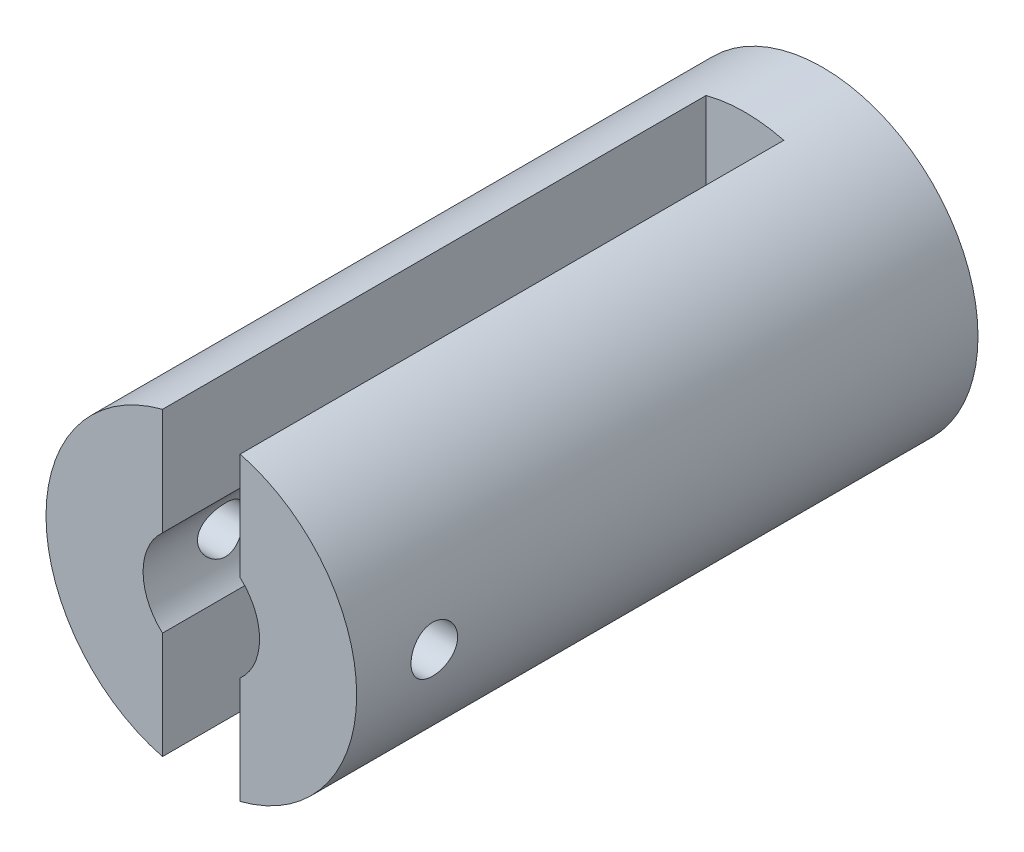
from build123d import *
from build123d.topology import SkipClean

# Parameters (mm, degrees)
CROQUIS1_R              = 10
CROQUIS1_R_2            = 2.25
SALIENTE_EXTRUIR1_DEPTH = 5
SALIENTE_EXTRUIR2_DEPTH = 35
CROQUIS3_R              = 1.5
CORTAR_EXTRUIR1_DEPTH   = 20
CROQUIS4_R              = 3.75
CORTAR_EXTRUIR2_DEPTH   = 2.5
CORTAR_EXTRUIR4_START   = 49
CROQUIS6_R              = 3.75
CORTAR_EXTRUIR4_DEPTH   = 49


with BuildPart() as part:
    # Croquis1 → Saliente-Extruir1 (new body)
    with BuildSketch(Plane.XY):
        Circle(CROQUIS1_R)
        Circle(CROQUIS1_R_2, mode=Mode.SUBTRACT)
    extrude(amount=SALIENTE_EXTRUIR1_DEPTH)

    # Croquis2 → Saliente-Extruir2 (add)
    with SkipClean():  # the faces are left unmerged after this step: merging them gives an invalid solid
        with BuildSketch(Plane.XY.offset(5)):
            with BuildLine():
                Line((-2.5, -9.682458366), (-2.5, 9.682458366))
                ThreePointArc((-2.5, 9.682458366), (-10, 0), (-2.5, -9.682458366))
            make_face()
            with BuildLine():
                Line((2.5, -9.682458366), (2.5, 9.682458366))
                ThreePointArc((2.5, 9.682458366), (10, 0), (2.5, -9.682458366))
            make_face()
        extrude(amount=SALIENTE_EXTRUIR2_DEPTH)
    add(part.part.scale(1), mode=Mode.REPLACE)  # the faces are merged on a copy

    # Croquis3 → Cortar-Extruir1 (cut, symmetric)
    with BuildSketch(Plane.ZY.offset(-2.5)):
        with Locations((35, 0)):
            Circle(CROQUIS3_R)
    extrude(amount=CORTAR_EXTRUIR1_DEPTH, both=True, mode=Mode.SUBTRACT)

    # Croquis4 → Cortar-Extruir2 (cut)
    with BuildSketch(Plane.XY.offset(5)):
        Circle(CROQUIS4_R)
    extrude(amount=-CORTAR_EXTRUIR2_DEPTH, mode=Mode.SUBTRACT)

    # Croquis6 → Cortar-Extruir4 (cut)
    with SkipClean():  # the faces are left unmerged after this step: merging them gives an invalid solid
        with BuildSketch(Plane.XY.offset(2.5).offset(CORTAR_EXTRUIR4_START)):
            Circle(CROQUIS6_R)
        extrude(amount=-CORTAR_EXTRUIR4_DEPTH, mode=Mode.SUBTRACT)


solid = part.part
